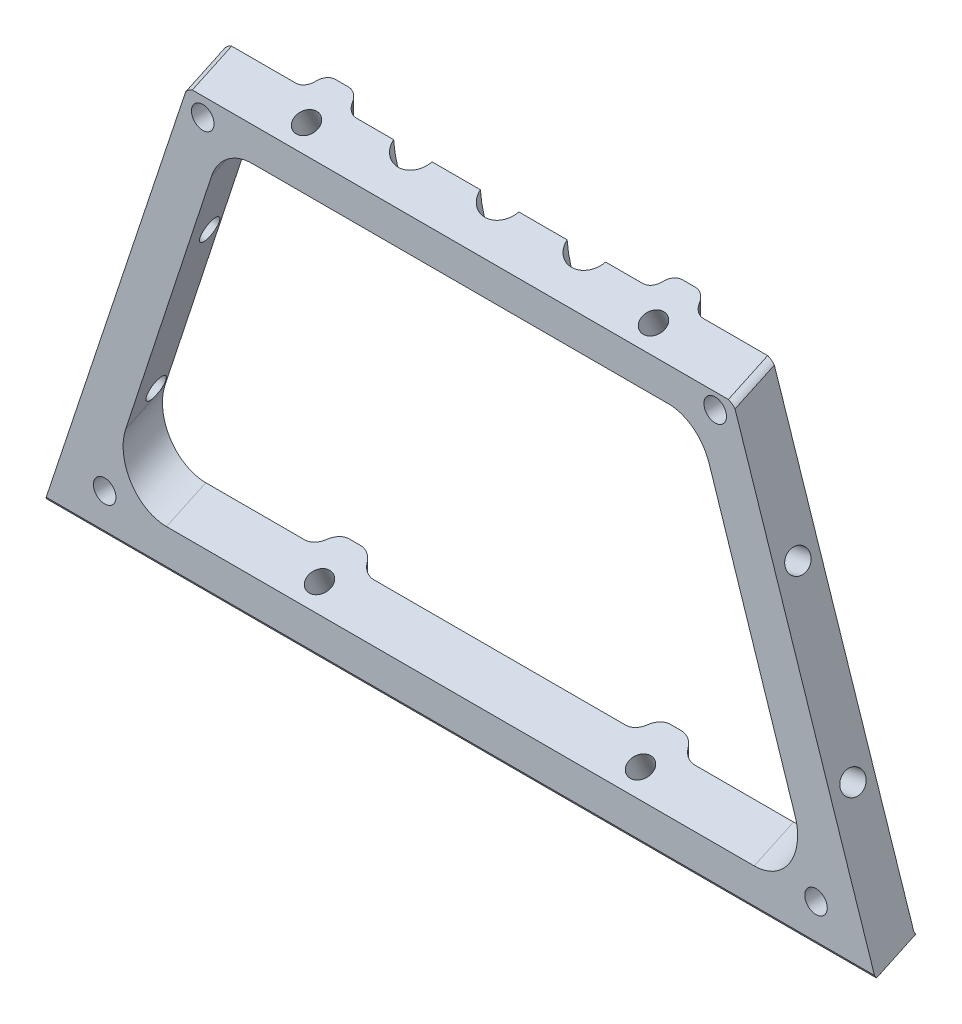
from build123d import *

# Parameters (mm, degrees)
BOSS_EXTRUDE1_START       = 4.874679861
BOSS_EXTRUDE1_DEPTH       = 51.575710535
BOSS_EXTRUDE1_START_2     = -3.000000017
BOSS_EXTRUDE1_2_OUTLINE_W = 194
BOSS_EXTRUDE1_2_OUTLINE_H = 105
BOSS_EXTRUDE1_2_DEPTH     = 39.000000017
BOSS_EXTRUDE1_START_3     = -51
BOSS_EXTRUDE1_3_OUTLINE_W = 194
BOSS_EXTRUDE1_3_OUTLINE_H = 105
BOSS_EXTRUDE1_3_DEPTH     = 38.936922113
FILLET1_R                 = 10
FILLET2_R                 = 10
FILLET3_R                 = 10
SKETCH3_W                 = 191.394666852
SKETCH3_H                 = 10
BOSS_EXTRUDE2_DEPTH       = 0.585312203
SKETCH4_R                 = 2.6
CUT_EXTRUDE1_DEPTH        = 10
SKETCH7_W                 = 76.681603499
SKETCH7_H                 = 120.522510291
CUT_EXTRUDE3_DEPTH        = 0.2
SKETCH8_W                 = 50.495719576
SKETCH8_H                 = 179.215252444
CUT_EXTRUDE4_DEPTH        = 0.2
SKETCH9_W                 = 172.346517838
SKETCH9_H                 = 32.794681532
CUT_EXTRUDE5_DEPTH        = 0.2
BOSS_EXTRUDE4_START       = -41
BOSS_EXTRUDE4_DEPTH       = 8
BOSS_EXTRUDE4_START_2     = 33
BOSS_EXTRUDE4_2_DEPTH     = 8
BOSS_EXTRUDE6_REACH       = 146.47
SKETCH23_W                = 8
SKETCH23_H                = 6.447128672
SKETCH23_H_2              = 7.052174758
SKETCH25_W                = 94.886099326
SKETCH25_H                = 16.143412247
CUT_EXTRUDE11_DEPTH       = 20
FILLET5_R                 = 4
FILLET7_R                 = 4
SKETCH10_R                = 2.599999996
CUT_EXTRUDE7_DEPTH        = 7.8357745
CUT_EXTRUDE8_REACH        = 201.677
SKETCH12_R                = 2.600000006
CUT_EXTRUDE9_REACH        = 201.677
SKETCH13_R                = 2.599999994
BOSS_EXTRUDE5_START       = 36
BOSS_EXTRUDE5_DEPTH       = 8
FILLET9_R                 = 3
FILLET10_R                = 3
SKETCH15_R                = 2.599999996
CUT_EXTRUDE10_DEPTH       = 7.050462296
FILLET9_OF_MIRROR2_R      = 3
FILLET10_OF_MIRROR2_R     = 3
FILLET11_R                = 4
SKETCH26_R                = 4.5
CUT_EXTRUDE12_DEPTH       = 15


with BuildPart() as part:
    # Boss-Extrude1: read off the stored shape, not the designer's step
    # Boss-Extrude1 outline → Boss-Extrude1 (new body)
    with BuildSketch(Plane(origin=(0, 0, 0), x_dir=(1, 0, 0), z_dir=(0, 0.4226182617407039, -0.9063077870366479)).offset(BOSS_EXTRUDE1_START)):
        with BuildLine():
            Line((95.697333426, -3.355179907), (-95.697333426, -3.355179907))
            Line((-95.697333426, -3.355179907), (-63.892333426, -90.340305173))
            add(Edge.make_bspline(
                [(-60.57, -92.514578876), (-63.097338019, -92.514578876), (-63.892333426, -90.340305173)],
                knots=[3.141592654, 3.141592654, 3.141592654, 4.392397576, 4.392397576, 4.392397576], degree=2, weights=[1, 0.810727575, 1]))
            Line((-60.57, -92.514578876), (60.57, -92.514578876))
            add(Edge.make_bspline(
                [(63.892333426, -90.340305173), (63.097338019, -92.514578876), (60.57, -92.514578876)],
                knots=[1.890787732, 1.890787732, 1.890787732, 3.141592654, 3.141592654, 3.141592654], degree=2, weights=[1, 0.810727575, 1]))
            Line((63.892333426, -90.340305173), (95.697333426, -3.355179907))
        make_face()
        Polygon((55, -85.26411658), (-55, -85.26411658), (-82, -10.605642204), (82, -10.605642204), align=None, mode=Mode.SUBTRACT)
    extrude(amount=BOSS_EXTRUDE1_DEPTH)

    # Boss-Extrude1 2 outline → Boss-Extrude1 2 (cut)
    with BuildSketch(Plane.XY.offset(BOSS_EXTRUDE1_START_2)):
        with Locations((0, 56.5)):
            Rectangle(BOSS_EXTRUDE1_2_OUTLINE_W, BOSS_EXTRUDE1_2_OUTLINE_H)
    extrude(amount=BOSS_EXTRUDE1_2_DEPTH, mode=Mode.SUBTRACT)

    # Boss-Extrude1 3 outline → Boss-Extrude1 3 (cut)
    with BuildSketch(Plane.XY.offset(BOSS_EXTRUDE1_START_3)):
        with Locations((0, 56.5)):
            Rectangle(BOSS_EXTRUDE1_3_OUTLINE_W, BOSS_EXTRUDE1_3_OUTLINE_H)
    extrude(amount=BOSS_EXTRUDE1_3_DEPTH, mode=Mode.SUBTRACT)

    # Fillet1
    fillet1_edges = [part.edges().sort_by_distance(p)[0] for p in [
        (82, 15.214045715, -7.531538952),
    ]]
    fillet(fillet1_edges, radius=FILLET1_R)

    # Fillet2
    fillet2_edges = [part.edges().sort_by_distance(p)[0] for p in [
        (-55, 97.590557805, -7.531538952),
        (-82, 15.214045715, -7.531538952),
    ]]
    fillet(fillet2_edges, radius=FILLET2_R)

    # Fillet3
    fillet3_edges = [part.edges().sort_by_distance(p)[0] for p in [
        (55, 97.590557805, -7.531538952),
    ]]
    fillet(fillet3_edges, radius=FILLET3_R)

    # Sketch3 → Boss-Extrude2 (add)
    with BuildSketch(Plane(origin=(0, 3.040825677, 1.4179603), x_dir=(1, 0, 0), z_dir=(-1.1200309043401983e-15, -0.906307787036648, -0.4226182617407039))):
        with Locations((0, -9.874679861)):
            Rectangle(SKETCH3_W, SKETCH3_H)
    extrude(amount=BOSS_EXTRUDE2_DEPTH)

    # Sketch4 → Cut-Extrude1 (cut)
    with BuildSketch(Plane.XY.offset(-3.000000017)):
        with Locations((82, 13.100954406)):
            Circle(SKETCH4_R)
        with Locations((-82, 13.100954406)):
            Circle(SKETCH4_R)
        with Locations((-59.392713729, 98.995171517)):
            Circle(SKETCH4_R)
        with Locations((58.757797989, 99.638339714)):
            Circle(SKETCH4_R)
    extrude(amount=-CUT_EXTRUDE1_DEPTH, mode=Mode.SUBTRACT)

    # Sketch7 → Cut-Extrude3 (cut)
    with BuildSketch(Plane(origin=(85.494325927, 28.331098282, 13.211008093), x_dir=(0.13776108927123742, 0.04565125132212272, -0.9894128792043928), z_dir=(0.9391884231490254, 0.3112281339441758, 0.1451280622914585))):
        with Locations((19.482436939, 30.359211689)):
            Rectangle(SKETCH7_W, SKETCH7_H)
    extrude(amount=-CUT_EXTRUDE3_DEPTH, mode=Mode.SUBTRACT)

    # Sketch8 → Cut-Extrude4 (cut)
    with BuildSketch(Plane(origin=(-85.494325927, 28.331098282, 13.211008093), x_dir=(0.13776108927124237, -0.045651251322124685, 0.9894128792043921), z_dir=(-0.9391884231490236, 0.3112281339441788, 0.14512806229146383))):
        with Locations((-21.244190838, 22.680558739)):
            Rectangle(SKETCH8_W, SKETCH8_H)
    extrude(amount=-CUT_EXTRUDE4_DEPTH, mode=Mode.SUBTRACT)

    # Sketch9 → Cut-Extrude5 (cut)
    with BuildSketch(Plane(origin=(0, 83.84668325, 39.09835051), x_dir=(1, 0, 0), z_dir=(1.1810911620941561e-15, 0.906307787036648, 0.4226182617407039))):
        with Locations((2.693251026, 51.915992053)):
            Rectangle(SKETCH9_W, SKETCH9_H)
    extrude(amount=-CUT_EXTRUDE5_DEPTH, mode=Mode.SUBTRACT)

    # Boss-Extrude4: read off the stored shape, not the designer's step
    # Boss-Extrude4 outline → Boss-Extrude4 (add)
    with BuildSketch(Plane.YZ.offset(BOSS_EXTRUDE4_START)):
        Polygon((9.327137023, -12.063077887), (11.01761007, -15.688309035), (19.01761007, -15.688309035), (17.327137023, -12.063077887), align=None)
    extrude(amount=BOSS_EXTRUDE4_DEPTH)

    # Boss-Extrude4 2 outline → Boss-Extrude4 2 (add)
    with BuildSketch(Plane.YZ.offset(BOSS_EXTRUDE4_START_2)):
        Polygon((9.327137023, -12.063077887), (11.01761007, -15.688309035), (19.01761007, -15.688309035), (17.327137023, -12.063077887), align=None)
    extrude(amount=BOSS_EXTRUDE4_2_DEPTH)

    # Boss-Extrude6: up to this plane
    boss_extrude6_end = Plane(origin=(-95.697333426, -164.902415704, -93.307652601), z_dir=(0, -0.4226182617407038, 0.9063077870366479))
    # Sketch23 → Boss-Extrude6 (add, up to the surface)
    with BuildSketch(Plane(origin=(0, 0, -15.688309035), x_dir=(-1, 0, 0), z_dir=(0, 0, -1)), mode=Mode.PRIVATE) as boss_extrude6_sk1:
        with Locations((-37, 7.794045734)):
            Rectangle(SKETCH23_W, SKETCH23_H)
    boss_extrude6_tool1 = split(extrude(boss_extrude6_sk1.sketch, amount=-BOSS_EXTRUDE6_REACH, mode=Mode.PRIVATE), bisect_by=boss_extrude6_end, keep=Keep.BOTH, mode=Mode.PRIVATE)
    add(boss_extrude6_tool1.solids().sort_by_distance((37, 7.794046, -15.688309))[0])
    # Sketch23 → Boss-Extrude6 (add, up to the surface)
    with BuildSketch(Plane(origin=(0, 0, -15.688309035), x_dir=(-1, 0, 0), z_dir=(0, 0, -1)), mode=Mode.PRIVATE) as boss_extrude6_sk2:
        with Locations((37, 7.491522691)):
            Rectangle(SKETCH23_W, SKETCH23_H_2)
    boss_extrude6_tool2 = split(extrude(boss_extrude6_sk2.sketch, amount=-BOSS_EXTRUDE6_REACH, mode=Mode.PRIVATE), bisect_by=boss_extrude6_end, keep=Keep.BOTH, mode=Mode.PRIVATE)
    add(boss_extrude6_tool2.solids().sort_by_distance((-37, 7.491523, -15.688309))[0])

    # Sketch25 → Cut-Extrude11 (cut)
    with BuildSketch(Plane(origin=(0, 2.510352669, 1.170596674), x_dir=(1, 0, 0), z_dir=(-1.039808498602085e-15, -0.9063077870366479, -0.42261826174070405))):
        with Locations((2.401661721, -17.291874028)):
            Rectangle(SKETCH25_W, SKETCH25_H)
    extrude(amount=CUT_EXTRUDE11_DEPTH, mode=Mode.SUBTRACT)

    # Fillet5
    # the kernel refuses this fillet: 4 mm, written as the material it adds along each edge
    with BuildSketch(Plane(origin=(33, 27.283149122, -12.063077887), x_dir=(0, 0, -1), z_dir=(0, -1, 0))) as fillet5_piece_1_section:
        with BuildLine():
            CenterArc((4, -3.98240484), FILLET5_R, 95.376053402, 84.623946598)
            Line((0, -3.98240484), (0, 0))
            Line((0, 0), (3.625231148, 0))
        make_face()
    fillet5_piece_1 = extrude(amount=27.912024199, mode=Mode.PRIVATE)
    fillet5_piece_1 = split(fillet5_piece_1, bisect_by=Plane(origin=(33, 12.003719017, -19.187993157), z_dir=(1.1200309043401985e-15, 0.906307787036648, 0.4226182617407039)), keep=Keep.TOP, mode=Mode.PRIVATE)
    fillet5_piece_1 = split(fillet5_piece_1, bisect_by=Plane(origin=(33, 19.105342463, -15.876451759), z_dir=(0, -0.9063077870265417, -0.42261826176237693)), keep=Keep.TOP, mode=Mode.PRIVATE)
    add(fillet5_piece_1)

    # Fillet7
    # the kernel refuses this fillet: 4 mm, written as the material it adds along each edge
    with BuildSketch(Plane(origin=(-41, 27.283149122, -12.063077887), x_dir=(-1, 0, 0), z_dir=(0, -1, 0))) as fillet7_piece_1_section:
        with BuildLine():
            CenterArc((3.98240484, 4), FILLET7_R, 185.376053402, 84.623946598)
            Line((0, 3.625231148), (0, 0))
            Line((0, 0), (3.98240484, 0))
        make_face()
    fillet7_piece_1 = extrude(amount=27.912024199, mode=Mode.PRIVATE)
    fillet7_piece_1 = split(fillet7_piece_1, bisect_by=Plane(origin=(-41, 12.003719017, -19.187993157), z_dir=(0, 0.9063077870365974, 0.42261826174081224)), keep=Keep.TOP, mode=Mode.PRIVATE)
    fillet7_piece_1 = split(fillet7_piece_1, bisect_by=Plane(origin=(-41, 19.105342464, -15.876451759), z_dir=(0, -0.9063077870366479, -0.4226182617407039)), keep=Keep.TOP, mode=Mode.PRIVATE)
    add(fillet7_piece_1)
    with BuildSketch(Plane(origin=(-33, -0.628875076, -12.063077887), x_dir=(1, 0, 0), z_dir=(0, 1, 0))) as fillet7_piece_2_section:
        with BuildLine():
            CenterArc((3.98240484, 4), FILLET7_R, 185.376053402, 84.623946598)
            Line((0, 3.625231148), (0, 0))
            Line((0, 0), (3.98240484, 0))
        make_face()
    fillet7_piece_2 = extrude(amount=27.912024199, mode=Mode.PRIVATE)
    fillet7_piece_2 = split(fillet7_piece_2, bisect_by=Plane(origin=(-33, 7.018458576, -8.49706764), z_dir=(0, 0.9063077870365974, 0.42261826174081224)), keep=Keep.TOP, mode=Mode.PRIVATE)
    fillet7_piece_2 = split(fillet7_piece_2, bisect_by=Plane(origin=(-33, 14.120082023, -5.185526242), z_dir=(0, -0.9063077870366479, -0.4226182617407039)), keep=Keep.TOP, mode=Mode.PRIVATE)
    add(fillet7_piece_2)
    with BuildSketch(Plane(origin=(41, -0.628875076, -12.063077887), x_dir=(0, 0, -1), z_dir=(0, 1, 0))) as fillet7_piece_3_section:
        with BuildLine():
            CenterArc((4, -3.98240484), FILLET7_R, 95.376053402, 84.623946598)
            Line((0, -3.98240484), (0, 0))
            Line((0, 0), (3.625231148, 0))
        make_face()
    fillet7_piece_3 = extrude(amount=27.912024199, mode=Mode.PRIVATE)
    fillet7_piece_3 = split(fillet7_piece_3, bisect_by=Plane(origin=(41, 14.120082021, -5.185526242), z_dir=(0, -0.906307787026768, -0.4226182617618918)), keep=Keep.TOP, mode=Mode.PRIVATE)
    fillet7_piece_3 = split(fillet7_piece_3, bisect_by=Plane(origin=(41, 7.018458576, -8.49706764), z_dir=(0, 0.9063077870365974, 0.42261826174081224)), keep=Keep.TOP, mode=Mode.PRIVATE)
    add(fillet7_piece_3)

    # Sketch10 → Cut-Extrude7 (cut)
    with BuildSketch(Plane(origin=(0, 9.611976116, 4.482138073), x_dir=(1, 0, 0), z_dir=(0, 0.906307787036648, 0.4226182617407039))):
        with Locations(Location((37, 13.255625955, 0), (0, 0, 270))):
            Circle(SKETCH10_R)
        with Locations(Location((-37, 13.255625955, 0), (0, 0, 270))):
            Circle(SKETCH10_R)
    extrude(amount=-CUT_EXTRUDE7_DEPTH, mode=Mode.SUBTRACT)

    # Cut-Extrude8: up to this plane
    cut_extrude8_end = Plane(origin=(-54.261116971, 101.957967882, -12.063077887), z_dir=(-0.9403928599993537, 0.30822629625609715, 0.1437282823889735))
    # Sketch12 → Cut-Extrude8 (cut, up to the surface)
    with BuildSketch(Plane(origin=(-85.306488243, 28.268852655, 13.18198248), x_dir=(0.13776108927124261, -0.04565125132212473, 0.989412879204392), z_dir=(-0.9391884231490243, 0.3112281339441767, 0.14512806229146408)), mode=Mode.PRIVATE) as cut_extrude8_sk1:
        with Locations(Location((-21.011142762, 47.636038184, 0), (0, 0, 270))):
            Circle(SKETCH12_R)
    cut_extrude8_tool1 = split(extrude(cut_extrude8_sk1.sketch, amount=-CUT_EXTRUDE8_REACH, mode=Mode.PRIVATE), bisect_by=cut_extrude8_end, keep=Keep.BOTH, mode=Mode.PRIVATE)
    add(cut_extrude8_tool1.solids().sort_by_distance((-73.21669, 74.445981, -7.606713))[0], mode=Mode.SUBTRACT)
    # Sketch12 → Cut-Extrude8 (cut, up to the surface)
    with BuildSketch(Plane(origin=(-85.306488243, 28.268852655, 13.18198248), x_dir=(0.13776108927124261, -0.04565125132212473, 0.989412879204392), z_dir=(-0.9391884231490243, 0.3112281339441767, 0.14512806229146408)), mode=Mode.PRIVATE) as cut_extrude8_sk2:
        with Locations(Location((-21.107956078, 7.636038184, 0), (0, 0, 270))):
            Circle(SKETCH12_R)
    cut_extrude8_tool2 = split(extrude(cut_extrude8_sk2.sketch, amount=-CUT_EXTRUDE8_REACH, mode=Mode.PRIVATE), bisect_by=cut_extrude8_end, keep=Keep.BOTH, mode=Mode.PRIVATE)
    add(cut_extrude8_tool2.solids().sort_by_distance((-85.812363, 36.480876, -7.702501))[0], mode=Mode.SUBTRACT)

    # Cut-Extrude9: up to this plane
    cut_extrude9_end = Plane(origin=(42.393286839, 138.166503154, -12.063077887), z_dir=(0.9403928599993542, 0.308226296256098, 0.1437282823889695))
    # Sketch13 → Cut-Extrude9 (cut, up to the surface)
    with BuildSketch(Plane(origin=(85.306488243, 28.268852655, 13.18198248), x_dir=(0.1377610892712373, 0.045651251322122756, -0.989412879204393), z_dir=(0.9391884231490254, 0.3112281339441758, 0.1451280622914584)), mode=Mode.PRIVATE) as cut_extrude9_sk1:
        with Locations(Location((21.011142762, 47.636038184, 0), (0, 0, 90))):
            Circle(SKETCH13_R)
    cut_extrude9_tool1 = split(extrude(cut_extrude9_sk1.sketch, amount=-CUT_EXTRUDE9_REACH, mode=Mode.PRIVATE), bisect_by=cut_extrude9_end, keep=Keep.BOTH, mode=Mode.PRIVATE)
    add(cut_extrude9_tool1.solids().sort_by_distance((73.21669, 74.445981, -7.606713))[0], mode=Mode.SUBTRACT)
    # Sketch13 → Cut-Extrude9 (cut, up to the surface)
    with BuildSketch(Plane(origin=(85.306488243, 28.268852655, 13.18198248), x_dir=(0.1377610892712373, 0.045651251322122756, -0.989412879204393), z_dir=(0.9391884231490254, 0.3112281339441758, 0.1451280622914584)), mode=Mode.PRIVATE) as cut_extrude9_sk2:
        with Locations(Location((21.107956078, 7.636038184, 0), (0, 0, 90))):
            Circle(SKETCH13_R)
    cut_extrude9_tool2 = split(extrude(cut_extrude9_sk2.sketch, amount=-CUT_EXTRUDE9_REACH, mode=Mode.PRIVATE), bisect_by=cut_extrude9_end, keep=Keep.BOTH, mode=Mode.PRIVATE)
    add(cut_extrude9_tool2.solids().sort_by_distance((85.812363, 36.480876, -7.702501))[0], mode=Mode.SUBTRACT)

    # Boss-Extrude5: read off the stored shape, not the designer's step
    # Boss-Extrude5 outline → Boss-Extrude5 (add)
    with BuildSketch(Plane.YZ.offset(BOSS_EXTRUDE5_START)):
        Polygon((99.703649113, -12.063077887), (101.39412216, -15.688309035), (109.173446577, -15.688309035), (107.48297353, -12.063077887), align=None)
    boss_extrude5 = extrude(amount=BOSS_EXTRUDE5_DEPTH)

    # Fillet9
    fillet9_edges = [part.edges().sort_by_distance(p)[0] for p in [
        (44, 103.593311321, -12.063077887),
        (36, 103.593311321, -12.063077887),
    ]]
    fillet(fillet9_edges, radius=FILLET9_R)

    # Fillet10
    fillet10_edges = [part.edges().sort_by_distance(p)[0] for p in [
        (36, 105.283784368, -15.688309035),
        (44, 105.283784368, -15.688309035),
    ]]
    fillet(fillet10_edges, radius=FILLET10_R)

    # Sketch15 → Cut-Extrude10 (cut)
    with BuildSketch(Plane(origin=(0, 83.665421692, 39.013826858), x_dir=(1, 0, 0), z_dir=(1.1528991411886154e-15, 0.906307787036648, 0.4226182617407039))):
        with Locations(Location((40, 51.357128865, 0), (0, 0, 270))):
            Circle(SKETCH15_R)
    cut_extrude10 = extrude(amount=-CUT_EXTRUDE10_DEPTH, mode=Mode.SUBTRACT)

    # Mirror2: Boss-Extrude5, Cut-Extrude10 across plane
    add(boss_extrude5.mirror(Plane(origin=(0, 0, 0), x_dir=(0, 0, 1), z_dir=(1, 0, 0))))
    add(cut_extrude10.mirror(Plane(origin=(0, 0, 0), x_dir=(0, 0, 1), z_dir=(1, 0, 0))), mode=Mode.SUBTRACT)

    # Fillet9 of Mirror2
    fillet9_of_mirror2_edges = [part.edges().sort_by_distance(p)[0] for p in [
        (-44, 103.593311321, -12.063077887),
        (-36, 103.593311321, -12.063077887),
    ]]
    fillet(fillet9_of_mirror2_edges, radius=FILLET9_OF_MIRROR2_R)

    # Fillet10 of Mirror2
    fillet10_of_mirror2_edges = [part.edges().sort_by_distance(p)[0] for p in [
        (-36, 105.283784368, -15.688309035),
        (-44, 105.283784368, -15.688309035),
    ]]
    fillet(fillet10_of_mirror2_edges, radius=FILLET10_OF_MIRROR2_R)

    # Fillet11
    fillet11_edges = [part.edges().sort_by_distance(p)[0] for p in [
        (-41, 15.01761007, -15.688309035),
        (-33, 15.01761007, -15.688309035),
        (41, 15.01761007, -15.688309035),
        (33, 15.01761007, -15.688309035),
    ]]
    fillet(fillet11_edges, radius=FILLET11_R)

    # Sketch26 → Cut-Extrude12 (cut)
    with BuildSketch(Plane(origin=(0, 85.91428785, 40.062490369), x_dir=(1, 0, 0), z_dir=(-1.039808498602085e-15, -0.9063077870366479, -0.42261826174070405))):
        with Locations((-20, -57.100447132)):
            Circle(SKETCH26_R)
        with Locations((0, -57.100447132)):
            Circle(SKETCH26_R)
        with Locations((20, -57.100447132)):
            Circle(SKETCH26_R)
    extrude(amount=CUT_EXTRUDE12_DEPTH, mode=Mode.SUBTRACT)


solid = part.part
